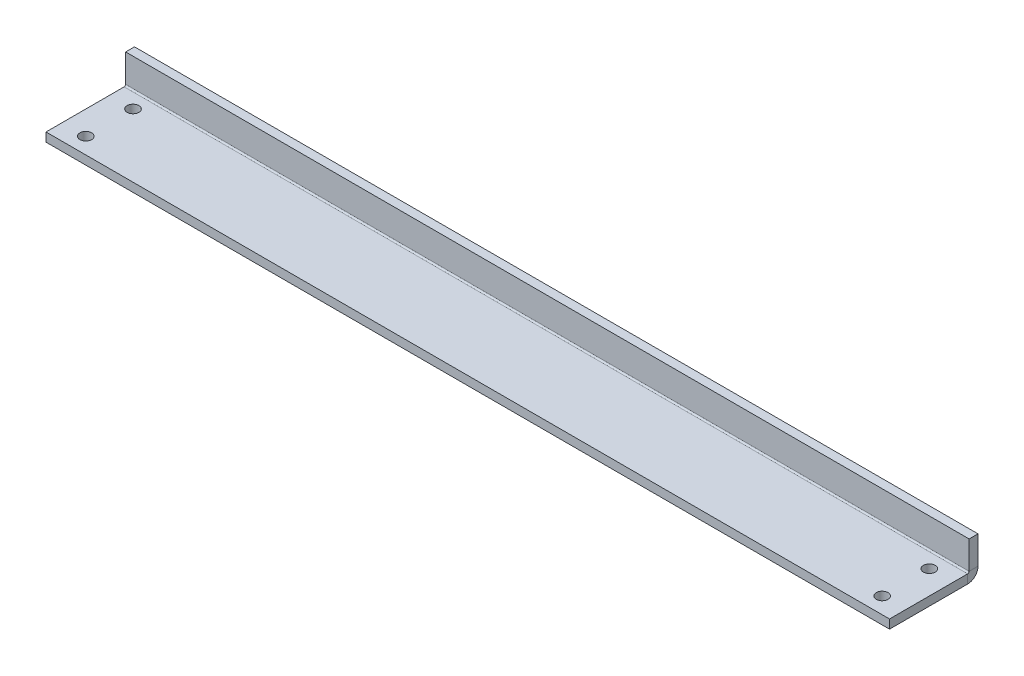
from build123d import *

# Parameters (mm, degrees)
SKETCH1_W                    = 286
SKETCH1_H                    = 27
SKETCH1_R                    = 2
BOSS_EXTRUDE1_DEPTH          = 3
EDGE_FLANGE3_STRIP_W         = 13
EDGE_FLANGE3_STRIP_H         = 3
EDGE_FLANGE3_STRIP_CUT_DEPTH = 286
EDGE_FLANGE3_DEPTH           = 286


# Sheet-metal steps are written as plain solids
with BuildPart() as part:
    # Sketch1 → Boss-Extrude1 (new body)
    with BuildSketch(Plane(origin=(0, 0, 0), x_dir=(1, 0, 0), z_dir=(0, 1, 0))):
        with Locations((-143, 13.5)):
            Rectangle(SKETCH1_W, SKETCH1_H)
        with Locations(Location((-278, 21.5, 0), (0, 0, 270))):
            Circle(SKETCH1_R, mode=Mode.SUBTRACT)
        with Locations(Location((-278, 5.5, 0), (0, 0, 270))):
            Circle(SKETCH1_R, mode=Mode.SUBTRACT)
        with Locations(Location((-8, 21.5, 0), (0, 0, 90))):
            Circle(SKETCH1_R, mode=Mode.SUBTRACT)
        with Locations(Location((-8, 5.5, 0), (0, 0, 90))):
            Circle(SKETCH1_R, mode=Mode.SUBTRACT)
    extrude(amount=BOSS_EXTRUDE1_DEPTH)

    # Edge-Flange3 strip (across the edge) → Edge-Flange3 strip cut (cut)
    with BuildSketch(Plane(origin=(0, 3, -27), x_dir=(0, 0, 1), z_dir=(-1, 0, 0))):
        with Locations((-6, -1.5)):
            Rectangle(EDGE_FLANGE3_STRIP_W, EDGE_FLANGE3_STRIP_H)
    extrude(amount=EDGE_FLANGE3_STRIP_CUT_DEPTH, mode=Mode.SUBTRACT)

    # Edge-Flange3 section (across the edge) → Edge-Flange3 (add)
    with BuildSketch(Plane(origin=(0, 3, -27), x_dir=(0, 0, 1), z_dir=(-1, 0, 0))):
        with BuildLine():
            Line((-3, 0.5), (-3, 10))
            Line((-3, 10), (0, 10))
            Line((0, 10), (0, 0.5))
            ThreePointArc((0, 0.5), (0.146446609, 0.146446609), (0.5, 0))
            Line((0.5, 0), (0.5, -3))
            ThreePointArc((0.5, -3), (-1.974873734, -1.974873734), (-3, 0.5))
        make_face()
    extrude(amount=EDGE_FLANGE3_DEPTH)


solid = part.part
